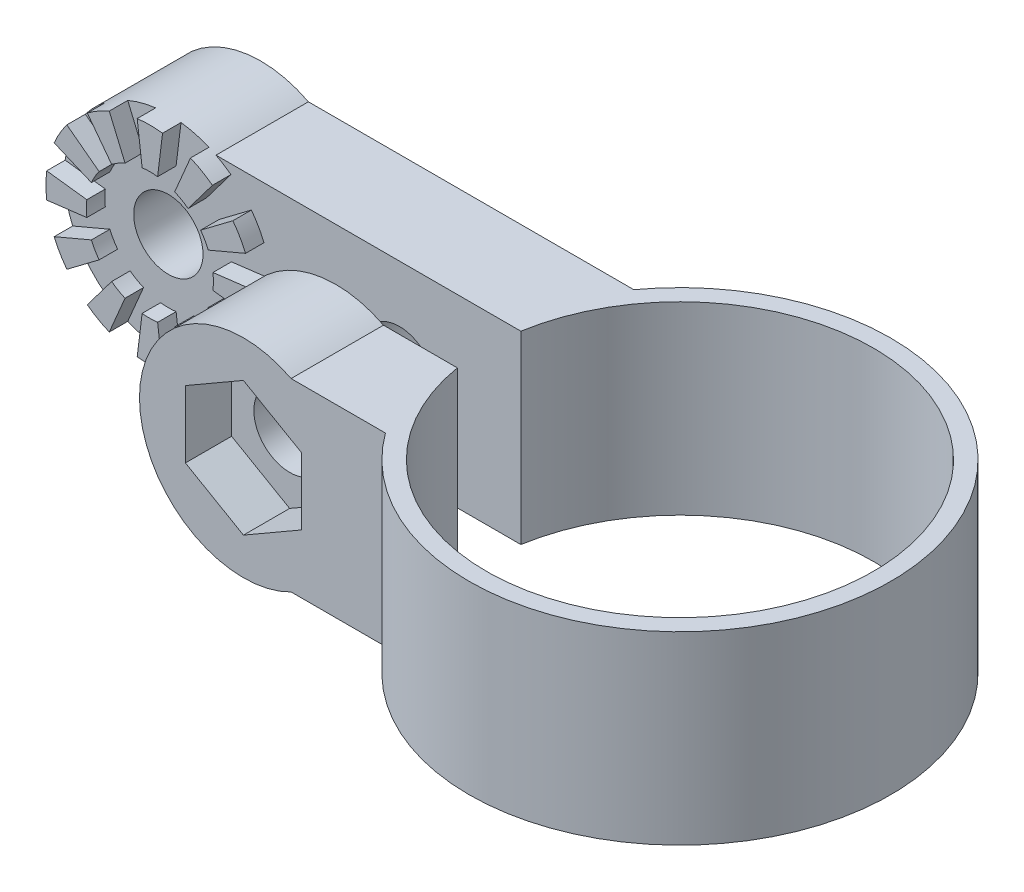
from build123d import *
from build123d.topology import SkipClean

# Parameters (mm, degrees)
SALIENTE_EXTRUIR1_DEPTH = 16
CROQUIS2_R              = 3.1
CORTAR_EXTRUIR1_DEPTH   = 500
CROQUIS3_R              = 9
CROQUIS3_R_2            = 3.1
SALIENTE_EXTRUIR2_DEPTH = 8
CORTAR_EXTRUIR2_DEPTH   = 4
CROQUIS7_R              = 9
SALIENTE_EXTRUIR3_DEPTH = 8
SALIENTE_EXTRUIR4_DEPTH = 1.6
CROQUIS9_R              = 3
CORTAR_EXTRUIR3_DEPTH   = 10
CORTAR_EXTRUIR4_START   = -8
CORTAR_EXTRUIR4_DEPTH   = 8
CORTAR_EXTRUIR6_START   = -8
CORTAR_EXTRUIR6_DEPTH   = 8


# Read off the part's stored shape, not the designer's step: Cortar-Extruir4, Cortar-Extruir6
with BuildPart() as part:
    # Croquis1 → Saliente-Extruir1 (new body)
    with BuildSketch(Plane(origin=(0, 0, 0), x_dir=(1, 0, 0), z_dir=(0, 1, 0))):
        with BuildLine():
            Line((-18.041618553, 2.75), (-56.041618553, 2.75))
            Line((-56.041618553, 2.75), (-56.041618553, 10.75))
            Line((-56.041618553, 10.75), (-14.747881204, 10.75))
            ThreePointArc((-14.747881204, 10.75), (18.25, 0), (-14.747881204, -10.75))
            Line((-14.747881204, -10.75), (-36.041618553, -10.75))
            Line((-36.041618553, -10.75), (-36.041618553, -2.75))
            Line((-36.041618553, -2.75), (-18.041618553, -2.75))
            Line((-18.041618553, -2.75), (-16.522711642, -2.75))
            ThreePointArc((-16.522711642, -2.75), (16.75, 0), (-16.522711642, 2.75))
            Line((-16.522711642, 2.75), (-18.041618553, 2.75))
        make_face()
    extrude(amount=SALIENTE_EXTRUIR1_DEPTH)

    # Croquis2 → Cortar-Extruir1 (cut)
    with BuildSketch(Plane.XY.offset(10.75)):
        with Locations((-27.041618553, 8)):
            Circle(CROQUIS2_R)
    extrude(amount=-CORTAR_EXTRUIR1_DEPTH, mode=Mode.SUBTRACT)

    # Croquis3 → Saliente-Extruir2 (add)
    with BuildSketch(Plane.XY.offset(10.75)):
        with Locations((-27.041618553, 8)):
            Circle(CROQUIS3_R)
        with Locations((-27.041618553, 8)):
            Circle(CROQUIS3_R_2, mode=Mode.SUBTRACT)
    extrude(amount=-SALIENTE_EXTRUIR2_DEPTH)

    # Croquis5 → Cortar-Extruir2 (cut)
    with BuildSketch(Plane.XY.offset(10.75)):
        Polygon((-27.041618553, 2.2), (-22.018671211, 5.1), (-22.018671211, 10.9), (-27.041618553, 13.8), (-32.064565895, 10.9), (-32.064565895, 5.1), align=None)
    extrude(amount=-CORTAR_EXTRUIR2_DEPTH, mode=Mode.SUBTRACT)

    # Croquis7 → Saliente-Extruir3 (add)
    with BuildSketch(Plane.XY.offset(-2.75)):
        with Locations((-47.041618553, 8)):
            Circle(CROQUIS7_R)
    extrude(amount=-SALIENTE_EXTRUIR3_DEPTH)

    # Croquis8 → Saliente-Extruir4 (add, symmetric)
    with SkipClean():  # the faces are left unmerged after this step: merging them gives an invalid solid
        with BuildSketch(Plane.XY.offset(-2.75)):
            with BuildLine():
                Line((-47.711899941, 13.459003834), (-48.138442643, 16.932915365))
                ThreePointArc((-48.138442643, 16.932915365), (-47.041618553, 17), (-45.944794462, 16.932915365))
                Line((-45.944794462, 16.932915365), (-46.371337164, 13.459003834))
                ThreePointArc((-46.371337164, 13.459003834), (-47.041618553, 13.5), (-47.711899941, 13.459003834))
            make_face()
            with BuildLine():
                Line((-43.731635925, 12.392495305), (-41.625283344, 15.18771959))
                ThreePointArc((-41.625283344, 15.18771959), (-42.541618553, 15.794228634), (-43.525038396, 16.284543681))
                Line((-43.525038396, 16.284543681), (-44.892597346, 13.062776694))
                ThreePointArc((-44.892597346, 13.062776694), (-44.291618553, 12.763139721), (-43.731635925, 12.392495305))
            make_face()
            with BuildLine():
                Line((-41.978841859, 10.149021207), (-38.757074872, 11.516580156))
                ThreePointArc((-38.757074872, 11.516580156), (-39.247389919, 12.5), (-39.853898962, 13.416335208))
                Line((-39.853898962, 13.416335208), (-42.649123247, 11.309982627))
                ThreePointArc((-42.649123247, 11.309982627), (-42.278478832, 10.75), (-41.978841859, 10.149021207))
            make_face()
            with BuildLine():
                Line((-41.582614719, 7.329718611), (-38.108703188, 6.903175909))
                ThreePointArc((-38.108703188, 6.903175909), (-38.041618553, 8), (-38.108703188, 9.096824091))
                Line((-38.108703188, 9.096824091), (-41.582614719, 8.670281389))
                ThreePointArc((-41.582614719, 8.670281389), (-41.541618553, 8), (-41.582614719, 7.329718611))
            make_face()
            with BuildLine():
                Line((-42.649123247, 4.690017373), (-39.853898962, 2.583664792))
                ThreePointArc((-39.853898962, 2.583664792), (-39.247389919, 3.5), (-38.757074872, 4.483419844))
                Line((-38.757074872, 4.483419844), (-41.978841859, 5.850978793))
                ThreePointArc((-41.978841859, 5.850978793), (-42.278478832, 5.25), (-42.649123247, 4.690017373))
            make_face()
            with BuildLine():
                Line((-44.892597346, 2.937223306), (-43.525038396, -0.284543681))
                ThreePointArc((-43.525038396, -0.284543681), (-42.541618553, 0.205771366), (-41.625283344, 0.81228041))
                Line((-41.625283344, 0.81228041), (-43.731635925, 3.607504695))
                ThreePointArc((-43.731635925, 3.607504695), (-44.291618553, 3.236860279), (-44.892597346, 2.937223306))
            make_face()
            with BuildLine():
                Line((-47.711899941, 2.540996166), (-48.138442643, -0.932915365))
                ThreePointArc((-48.138442643, -0.932915365), (-47.041618553, -1), (-45.944794462, -0.932915365))
                Line((-45.944794462, -0.932915365), (-46.371337164, 2.540996166))
                ThreePointArc((-46.371337164, 2.540996166), (-47.041618553, 2.5), (-47.711899941, 2.540996166))
            make_face()
            with BuildLine():
                Line((-50.35160118, 3.607504695), (-52.457953761, 0.81228041))
                ThreePointArc((-52.457953761, 0.81228041), (-51.541618553, 0.205771366), (-50.558198709, -0.284543681))
                Line((-50.558198709, -0.284543681), (-49.190639759, 2.937223306))
                ThreePointArc((-49.190639759, 2.937223306), (-49.791618553, 3.236860279), (-50.35160118, 3.607504695))
            make_face()
            with BuildLine():
                Line((-52.104395247, 5.850978793), (-55.326162234, 4.483419844))
                ThreePointArc((-55.326162234, 4.483419844), (-54.835847187, 3.5), (-54.229338143, 2.583664792))
                Line((-54.229338143, 2.583664792), (-51.434113858, 4.690017373))
                ThreePointArc((-51.434113858, 4.690017373), (-51.804758273, 5.25), (-52.104395247, 5.850978793))
            make_face()
            with BuildLine():
                Line((-52.500622387, 8.670281389), (-55.974533917, 9.096824091))
                ThreePointArc((-55.974533917, 9.096824091), (-56.041618553, 8), (-55.974533917, 6.903175909))
                Line((-55.974533917, 6.903175909), (-52.500622387, 7.329718611))
                ThreePointArc((-52.500622387, 7.329718611), (-52.541618553, 8), (-52.500622387, 8.670281389))
            make_face()
            with BuildLine():
                Line((-51.434113858, 11.309982627), (-54.229338143, 13.416335208))
                ThreePointArc((-54.229338143, 13.416335208), (-54.835847187, 12.5), (-55.326162234, 11.516580156))
                Line((-55.326162234, 11.516580156), (-52.104395247, 10.149021207))
                ThreePointArc((-52.104395247, 10.149021207), (-51.804758273, 10.75), (-51.434113858, 11.309982627))
            make_face()
            with BuildLine():
                Line((-49.190639759, 13.062776694), (-50.558198709, 16.284543681))
                ThreePointArc((-50.558198709, 16.284543681), (-51.541618553, 15.794228634), (-52.457953761, 15.18771959))
                Line((-52.457953761, 15.18771959), (-50.35160118, 12.392495305))
                ThreePointArc((-50.35160118, 12.392495305), (-49.791618553, 12.763139721), (-49.190639759, 13.062776694))
            make_face()
        extrude(amount=SALIENTE_EXTRUIR4_DEPTH, both=True)

    # Croquis9 → Cortar-Extruir3 (cut)
    with SkipClean():  # the faces are left unmerged after this step: merging them gives an invalid solid
        with BuildSketch(Plane.XY.offset(-2.75)):
            with Locations((-47.041618553, 8)):
                Circle(CROQUIS9_R)
        extrude(amount=-CORTAR_EXTRUIR3_DEPTH, mode=Mode.SUBTRACT)

    # Cortar-Extruir4 outline → Cortar-Extruir4 (cut)
    with SkipClean():  # the faces are left unmerged after this step: merging them gives an invalid solid
        with BuildSketch(Plane(origin=(0, 0, -10.75), x_dir=(-1, 0, 0), z_dir=(0, 0, -1)).offset(CORTAR_EXTRUIR4_START)):
            with BuildLine():
                Line((56.041618553, 16), (51.164724178, 16))
                ThreePointArc((51.164724178, 16), (54.726276991, 12.684658439), (56.041618553, 8))
                Line((56.041618553, 8), (56.041618553, 16))
            make_face()
            with BuildLine():
                Line((56.041618553, 0), (56.041618553, 8))
                ThreePointArc((56.041618553, 8), (54.726276991, 3.315341561), (51.164724178, 0))
                Line((51.164724178, 0), (56.041618553, 0))
            make_face()
        extrude(amount=CORTAR_EXTRUIR4_DEPTH, mode=Mode.SUBTRACT)

    # Cortar-Extruir6 outline → Cortar-Extruir6 (cut)
    with SkipClean():  # the faces are left unmerged after this step: merging them gives an invalid solid
        with BuildSketch(Plane.XY.offset(10.75).offset(CORTAR_EXTRUIR6_START)):
            with BuildLine():
                ThreePointArc((-31.164724178, 0), (-34.726276991, 3.315341561), (-36.041618553, 8))
                Line((-36.041618553, 8), (-36.041618553, 0))
                Line((-36.041618553, 0), (-31.164724178, 0))
            make_face()
            with BuildLine():
                ThreePointArc((-36.041618553, 8), (-34.726276991, 12.684658439), (-31.164724178, 16))
                Line((-31.164724178, 16), (-36.041618553, 16))
                Line((-36.041618553, 16), (-36.041618553, 8))
            make_face()
        extrude(amount=CORTAR_EXTRUIR6_DEPTH, mode=Mode.SUBTRACT)


solid = part.part
